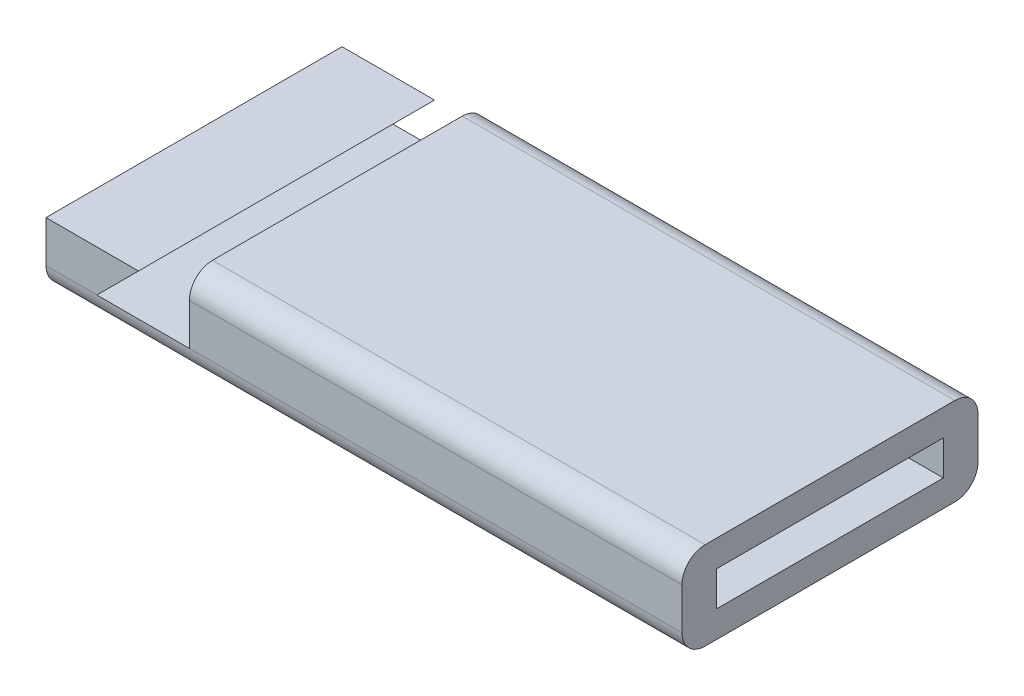
from build123d import *

# Parameters (mm, degrees)
SKETCH1_W           = 55
SKETCH1_H           = 25.6
BOSS_EXTRUDE1_DEPTH = 7.6
CUT_EXTRUDE1_DEPTH  = 25.6
FILLET1_R           = 2
SKETCH3_W           = 19.6
SKETCH3_H           = 3
CUT_EXTRUDE2_DEPTH  = 10


with BuildPart() as part:
    # Sketch1 → Boss-Extrude1 (new body)
    with BuildSketch(Plane(origin=(0, 0, 0), x_dir=(1, 0, 0), z_dir=(0, 1, 0))):
        with Locations((27.5, 12.8)):
            Rectangle(SKETCH1_W, SKETCH1_H)
    extrude(amount=BOSS_EXTRUDE1_DEPTH)

    # Sketch2 → Cut-Extrude1 (cut)
    with BuildSketch(Plane(origin=(0, 0, -25.6), x_dir=(-1, 0, 0), z_dir=(0, 0, -1))):
        Polygon((-8, 5.6), (-4.4, 2), (-12.4, 2), (-12.4, 7.6), (0, 7.6), (0, 5.6), align=None)
    extrude(amount=-CUT_EXTRUDE1_DEPTH, mode=Mode.SUBTRACT)

    # Fillet1
    fillet1_edges = [part.edges().sort_by_distance(p)[0] for p in [
        (33.7, 7.6, -25.6),
        (33.7, 7.6, 0),
        (27.5, 0, -25.6),
        (27.5, 0, 0),
    ]]
    fillet(fillet1_edges, radius=FILLET1_R - 0.0001)  # a hair under: the kernel refuses the full size

    # Sketch3 → Cut-Extrude2 (cut)
    with BuildSketch(Plane(origin=(55, 0, 0), x_dir=(0, 0, -1), z_dir=(1, 0, 0))):
        with Locations((12.8, 3.8)):
            Rectangle(SKETCH3_W, SKETCH3_H)
    extrude(amount=-CUT_EXTRUDE2_DEPTH, mode=Mode.SUBTRACT)


solid = part.part
